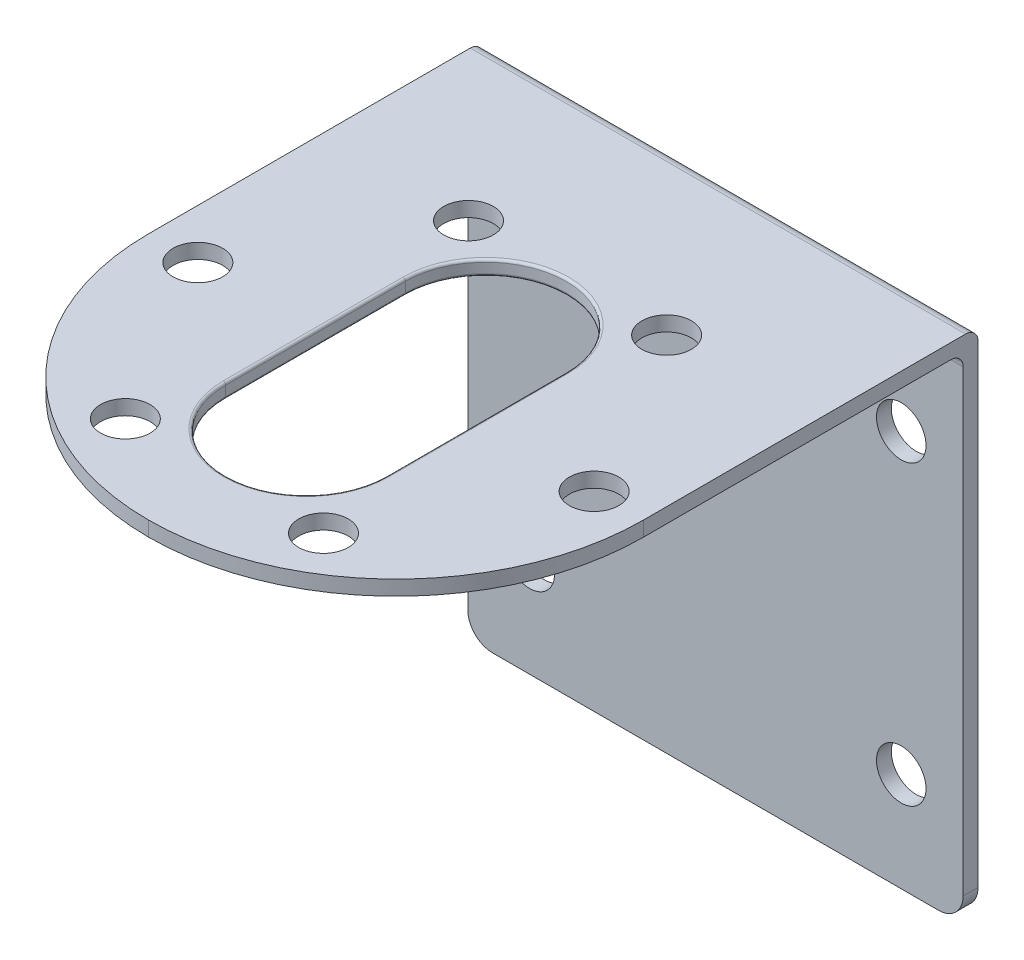
from build123d import *

# Parameters (mm, degrees)
SKETCH_2_W          = 40
SKETCH_2_H          = 40
SKETCH_2_R          = 2
EXTRUDE_1_DEPTH     = 1.2
SKETCH_3_W          = 40
SKETCH_3_H          = 47
EXTRUDE_2_DEPTH     = 1.2
FILLET_1_R          = 1
FILLET_2_R          = 20
FILLET_3_R          = 2
CUT_EXTRUDE_1_DEPTH = 75.20539064
SKETCH_7_R          = 2
CUT_EXTRUDE_3_DEPTH = 75.20539064
FILLET_4_R          = 0.2


with BuildPart() as part:
    # 草图2 → 凸台-拉伸1 (new body)
    with BuildSketch(Plane.XY):
        with Locations((20, 20)):
            Rectangle(SKETCH_2_W, SKETCH_2_H)
        with Locations((5, 32)):
            Circle(SKETCH_2_R, mode=Mode.SUBTRACT)
        with Locations((35, 8)):
            Circle(SKETCH_2_R, mode=Mode.SUBTRACT)
        with Locations((5, 8)):
            Circle(SKETCH_2_R, mode=Mode.SUBTRACT)
        with Locations((35, 32)):
            Circle(SKETCH_2_R, mode=Mode.SUBTRACT)
    extrude(amount=EXTRUDE_1_DEPTH)

    # 草图3 → 凸台-拉伸2 (add)
    with BuildSketch(Plane(origin=(0, 40, 0), x_dir=(1, 0, 0), z_dir=(0, 1, 0))):
        with Locations((20, -23.5)):
            Rectangle(SKETCH_3_W, SKETCH_3_H)
    extrude(amount=EXTRUDE_2_DEPTH)

    # 圆角1
    fillet_1_edges = [part.edges().sort_by_distance(p)[0] for p in [
        (20, 40, 1.2),
        (20, 41.2, 0),
    ]]
    fillet(fillet_1_edges, radius=FILLET_1_R)

    # 圆角2
    fillet_2_edges = [part.edges().sort_by_distance(p)[0] for p in [
        (0, 40.6, 47),
        (40, 40.6, 47),
    ]]
    fillet(fillet_2_edges, radius=FILLET_2_R - 0.0001)  # a hair under: the kernel refuses the full size

    # 圆角3
    fillet_3_edges = [part.edges().sort_by_distance(p)[0] for p in [
        (40, 0, 0.6),
        (0, 0, 0.6),
    ]]
    fillet(fillet_3_edges, radius=FILLET_3_R)

    # 草图5 → 切除-拉伸1 (cut, through all)
    with BuildSketch(Plane(origin=(0, 41.2, 0), x_dir=(1, 0, 0), z_dir=(0, 1, 0))):
        with BuildLine():
            Line((26.5, -19.75), (26.5, -34.25))
            ThreePointArc((26.5, -34.25), (20, -40.75), (13.5, -34.25))
            Line((13.5, -34.25), (13.5, -19.75))
            ThreePointArc((13.5, -19.75), (20, -13.25), (26.5, -19.75))
        make_face()
    extrude(amount=-CUT_EXTRUDE_1_DEPTH, mode=Mode.SUBTRACT)

    # 草图7 → 切除-拉伸3 (cut, through all)
    with BuildSketch(Plane(origin=(0, 41.2, 0), x_dir=(1, 0, 0), z_dir=(0, 1, 0))):
        with Locations(Location((36, -27, 0), (0, 0, 270))):
            Circle(SKETCH_7_R)
        with Locations(Location((4, -27, 0), (0, 0, 270))):
            Circle(SKETCH_7_R)
        with Locations(Location((28, -40.856406461, 0), (0, 0, 270))):
            Circle(SKETCH_7_R)
        with Locations(Location((12, -40.856406461, 0), (0, 0, 270))):
            Circle(SKETCH_7_R)
        with Locations(Location((28, -13.143593539, 0), (0, 0, 270))):
            Circle(SKETCH_7_R)
        with Locations(Location((12, -13.143593539, 0), (0, 0, 270))):
            Circle(SKETCH_7_R)
    extrude(amount=-CUT_EXTRUDE_3_DEPTH, mode=Mode.SUBTRACT)

    # 圆角4
    fillet_4_edges = [part.edges().sort_by_distance(p)[0] for p in [
        (20, 40, 13.25),
        (26.5, 40, 27),
        (20, 40, 40.75),
        (13.5, 40, 27),
        (20, 41.2, 13.25),
        (13.5, 41.2, 27),
        (20, 41.2, 40.75),
        (26.5, 41.2, 27),
    ]]
    fillet(fillet_4_edges, radius=FILLET_4_R)


solid = part.part
